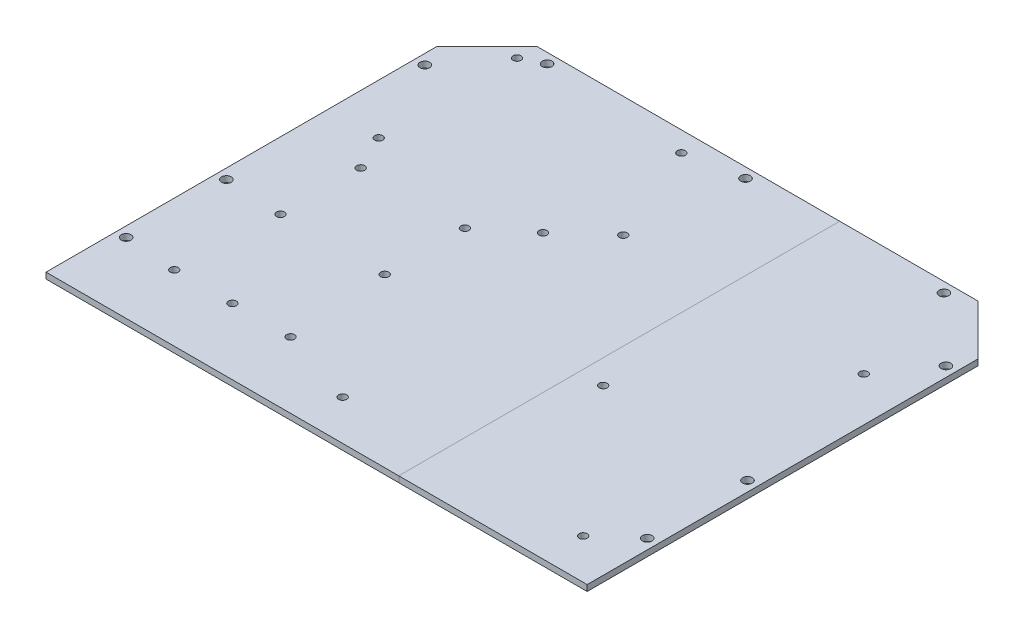
from build123d import *
from build123d.topology import SkipClean

# Parameters (mm, degrees)
SKETCH1_W                        = 270
SKETCH1_H                        = 270
BOSS_EXTRUDE1_DEPTH              = 3
M4_CLEARANCE_HOLE1_D             = 4.8
SKETCH6_W                        = 270
SKETCH6_H                        = 50
CUT_EXTRUDE1_DEPTH               = 191.942399692
F_4_0_4_DIAMETER_HOLE1_OUTLINE_R = 2
F_4_0_4_DIAMETER_HOLE1_DEPTH     = 3
CHAMFER1_SIZE                    = 25
BOSS_EXTRUDE2_START              = 2.5
SKETCH10_R                       = 5
SKETCH10_R_2                     = 2
BOSS_EXTRUDE2_DEPTH              = 2.5
FILLET1_R                        = 10


# Read off the part's stored shape, not the designer's step: Ø4.0 (4) Diameter Hole1
with BuildPart() as part:
    # Sketch1 → Boss-Extrude1 (new body)
    with BuildSketch(Plane(origin=(0, 0, 0), x_dir=(1, 0, 0), z_dir=(0, 1, 0))):
        Rectangle(SKETCH1_W, SKETCH1_H)
    extrude(amount=BOSS_EXTRUDE1_DEPTH)

    # M4 Clearance Hole1 (through all)
    with Locations(Plane(origin=(0, 3, 0), x_dir=(1, 0, 0), z_dir=(0, 1, 0))):
        with Locations((98, 130), (-1, 130), (-100, 130), (130, -50), (-130, -50), (-130, 0), (130, 99), (-130, 99), (130, 0)):
            Hole(M4_CLEARANCE_HOLE1_D / 2)

    # Sketch6 → Cut-Extrude1 (cut, through all)
    with BuildSketch(Plane(origin=(0, 3, 0), x_dir=(1, 0, 0), z_dir=(0, 1, 0))):
        with Locations((0, -110)):
            Rectangle(SKETCH6_W, SKETCH6_H)
    extrude(amount=-CUT_EXTRUDE1_DEPTH, mode=Mode.SUBTRACT)

    # Ø4.0 (4) Diameter Hole1 outline → Ø4.0 (4) Diameter Hole1 (cut)
    with BuildSketch(Plane(origin=(0, 0, 0), x_dir=(1, 0, 0), z_dir=(0, 1, 0))):
        with Locations((-75, -52)):
            Circle(F_4_0_4_DIAMETER_HOLE1_OUTLINE_R)
        with Locations((-104, -52)):
            Circle(F_4_0_4_DIAMETER_HOLE1_OUTLINE_R)
        with Locations((-46, -52)):
            Circle(F_4_0_4_DIAMETER_HOLE1_OUTLINE_R)
        with Locations((53, 5)):
            Circle(F_4_0_4_DIAMETER_HOLE1_OUTLINE_R)
        with Locations((113, -65)):
            Circle(F_4_0_4_DIAMETER_HOLE1_OUTLINE_R)
        with Locations((-7, 75)):
            Circle(F_4_0_4_DIAMETER_HOLE1_OUTLINE_R)
        with Locations((-7, -65)):
            Circle(F_4_0_4_DIAMETER_HOLE1_OUTLINE_R)
        with Locations((113, 75)):
            Circle(F_4_0_4_DIAMETER_HOLE1_OUTLINE_R)
        with Locations((-49.5, -1.5)):
            Circle(F_4_0_4_DIAMETER_HOLE1_OUTLINE_R)
        with Locations((-49.5, 38.5)):
            Circle(F_4_0_4_DIAMETER_HOLE1_OUTLINE_R)
        with Locations((-101.5, -1.5)):
            Circle(F_4_0_4_DIAMETER_HOLE1_OUTLINE_R)
        with Locations((-101.5, 38.5)):
            Circle(F_4_0_4_DIAMETER_HOLE1_OUTLINE_R)
        with Locations((-28, 56)):
            Circle(F_4_0_4_DIAMETER_HOLE1_OUTLINE_R)
        with Locations((-110, 56)):
            Circle(F_4_0_4_DIAMETER_HOLE1_OUTLINE_R)
        with Locations((-28, 125)):
            Circle(F_4_0_4_DIAMETER_HOLE1_OUTLINE_R)
        with Locations((-110, 125)):
            Circle(F_4_0_4_DIAMETER_HOLE1_OUTLINE_R)
    extrude(amount=F_4_0_4_DIAMETER_HOLE1_DEPTH, mode=Mode.SUBTRACT)

    # Chamfer1
    chamfer1_edges = [part.edges().sort_by_distance(p)[0] for p in [
        (-135, 1.5, -135),
        (135, 1.5, -135),
    ]]
    chamfer(chamfer1_edges, length=CHAMFER1_SIZE)

    # Sketch10 → Boss-Extrude2 (add)
    # profile 1 of 16: a face of its own
    with SkipClean():  # the faces are left unmerged after this step: merging them gives an invalid solid
        with BuildSketch(Plane.XZ.offset(BOSS_EXTRUDE2_START)):
            with Locations(Location((-75, 52, 0), (0, 0, 270))):
                Circle(SKETCH10_R)
            with Locations(Location((-75, 52, 0), (0, 0, 90))):
                Circle(SKETCH10_R_2, mode=Mode.SUBTRACT)
        # profile 2 of 16: a face of its own
        with BuildSketch(Plane.XZ.offset(BOSS_EXTRUDE2_START)):
            with Locations(Location((-104, 52, 0), (0, 0, 270))):
                Circle(SKETCH10_R)
            with Locations(Location((-104, 52, 0), (0, 0, 90))):
                Circle(SKETCH10_R_2, mode=Mode.SUBTRACT)
        # profile 3 of 16: a face of its own
        with BuildSketch(Plane.XZ.offset(BOSS_EXTRUDE2_START)):
            with Locations(Location((-46, 52, 0), (0, 0, 270))):
                Circle(SKETCH10_R)
            with Locations(Location((-46, 52, 0), (0, 0, 90))):
                Circle(SKETCH10_R_2, mode=Mode.SUBTRACT)
        # profile 4 of 16: a face of its own
        with BuildSketch(Plane.XZ.offset(BOSS_EXTRUDE2_START)):
            with Locations(Location((53, -5, 0), (0, 0, 270))):
                Circle(SKETCH10_R)
            with Locations(Location((53, -5, 0), (0, 0, 90))):
                Circle(SKETCH10_R_2, mode=Mode.SUBTRACT)
        # profile 5 of 16: a face of its own
        with BuildSketch(Plane.XZ.offset(BOSS_EXTRUDE2_START)):
            with Locations(Location((113, 65, 0), (0, 0, 270))):
                Circle(SKETCH10_R)
            with Locations(Location((113, 65, 0), (0, 0, 90))):
                Circle(SKETCH10_R_2, mode=Mode.SUBTRACT)
        # profile 6 of 16: a face of its own
        with BuildSketch(Plane.XZ.offset(BOSS_EXTRUDE2_START)):
            with Locations(Location((-7, -75, 0), (0, 0, 270))):
                Circle(SKETCH10_R)
            with Locations(Location((-7, -75, 0), (0, 0, 90))):
                Circle(SKETCH10_R_2, mode=Mode.SUBTRACT)
        # profile 7 of 16: a face of its own
        with BuildSketch(Plane.XZ.offset(BOSS_EXTRUDE2_START)):
            with Locations(Location((-7, 65, 0), (0, 0, 270))):
                Circle(SKETCH10_R)
            with Locations(Location((-7, 65, 0), (0, 0, 90))):
                Circle(SKETCH10_R_2, mode=Mode.SUBTRACT)
        # profile 8 of 16: a face of its own
        with BuildSketch(Plane.XZ.offset(BOSS_EXTRUDE2_START)):
            with Locations(Location((113, -75, 0), (0, 0, 270))):
                Circle(SKETCH10_R)
            with Locations(Location((113, -75, 0), (0, 0, 90))):
                Circle(SKETCH10_R_2, mode=Mode.SUBTRACT)
        # profile 9 of 16: a face of its own
        with BuildSketch(Plane.XZ.offset(BOSS_EXTRUDE2_START)):
            with Locations(Location((-49.5, 1.5, 0), (0, 0, 270))):
                Circle(SKETCH10_R)
            with Locations(Location((-49.5, 1.5, 0), (0, 0, 90))):
                Circle(SKETCH10_R_2, mode=Mode.SUBTRACT)
        # profile 10 of 16: a face of its own
        with BuildSketch(Plane.XZ.offset(BOSS_EXTRUDE2_START)):
            with Locations(Location((-49.5, -38.5, 0), (0, 0, 270))):
                Circle(SKETCH10_R)
            with Locations(Location((-49.5, -38.5, 0), (0, 0, 90))):
                Circle(SKETCH10_R_2, mode=Mode.SUBTRACT)
        # profile 11 of 16: a face of its own
        with BuildSketch(Plane.XZ.offset(BOSS_EXTRUDE2_START)):
            with Locations(Location((-101.5, 1.5, 0), (0, 0, 270))):
                Circle(SKETCH10_R)
            with Locations(Location((-101.5, 1.5, 0), (0, 0, 90))):
                Circle(SKETCH10_R_2, mode=Mode.SUBTRACT)
        # profile 12 of 16: a face of its own
        with BuildSketch(Plane.XZ.offset(BOSS_EXTRUDE2_START)):
            with Locations(Location((-101.5, -38.5, 0), (0, 0, 270))):
                Circle(SKETCH10_R)
            with Locations(Location((-101.5, -38.5, 0), (0, 0, 90))):
                Circle(SKETCH10_R_2, mode=Mode.SUBTRACT)
        # profile 13 of 16: a face of its own
        with BuildSketch(Plane.XZ.offset(BOSS_EXTRUDE2_START)):
            with Locations(Location((-28, -56, 0), (0, 0, 270))):
                Circle(SKETCH10_R)
            with Locations(Location((-28, -56, 0), (0, 0, 90))):
                Circle(SKETCH10_R_2, mode=Mode.SUBTRACT)
        # profile 14 of 16: a face of its own
        with BuildSketch(Plane.XZ.offset(BOSS_EXTRUDE2_START)):
            with Locations(Location((-110, -56, 0), (0, 0, 270))):
                Circle(SKETCH10_R)
            with Locations(Location((-110, -56, 0), (0, 0, 90))):
                Circle(SKETCH10_R_2, mode=Mode.SUBTRACT)
        # profile 15 of 16: a face of its own
        with BuildSketch(Plane.XZ.offset(BOSS_EXTRUDE2_START)):
            with Locations(Location((-28, -125, 0), (0, 0, 270))):
                Circle(SKETCH10_R)
            with Locations(Location((-28, -125, 0), (0, 0, 90))):
                Circle(SKETCH10_R_2, mode=Mode.SUBTRACT)
        # profile 16 of 16: a face of its own
        with BuildSketch(Plane.XZ.offset(BOSS_EXTRUDE2_START)):
            with Locations(Location((-110, -125, 0), (0, 0, 270))):
                Circle(SKETCH10_R)
            with Locations(Location((-110, -125, 0), (0, 0, 90))):
                Circle(SKETCH10_R_2, mode=Mode.SUBTRACT)
        extrude(amount=-BOSS_EXTRUDE2_DEPTH)

    # Fillet1
    # the kernel refuses this fillet: 10 mm, written as the material it adds along each edge
    with BuildSketch(Plane(origin=(-7, 0, -75), x_dir=(0, 0, -1), z_dir=(-1, 0, 0))) as fillet1_piece_1:
        with BuildLine():
            CenterArc((11.614378278, 10), FILLET1_R, 228.590377891, 41.409622109)
            Line((5, 2.5), (4.867712434, 2.35))
            ThreePointArc((4.867712434, 2.35), (4.8, 1.25), (4.8, 0))
            Line((4.8, 0), (5, -0.2))
            Line((5, -0.2), (11.614378278, -0.2))
            Line((11.614378278, -0.2), (11.614378278, 0))
        make_face()
    revolve(axis=Axis((-7, 0, -75), (0, -1, 0)))
    with BuildSketch(Plane(origin=(-7, 0, 65), x_dir=(0, 0, -1), z_dir=(-1, 0, 0))) as fillet1_piece_2:
        with BuildLine():
            CenterArc((11.614378278, 10), FILLET1_R, 228.590377891, 41.409622109)
            Line((5, 2.5), (4.867712434, 2.35))
            ThreePointArc((4.867712434, 2.35), (4.8, 1.25), (4.8, 0))
            Line((4.8, 0), (5, -0.2))
            Line((5, -0.2), (11.614378278, -0.2))
            Line((11.614378278, -0.2), (11.614378278, 0))
        make_face()
    revolve(axis=Axis((-7, 0, 65), (0, -1, 0)))
    with BuildSketch(Plane(origin=(113, 0, -75), x_dir=(0, 0, -1), z_dir=(-1, 0, 0))) as fillet1_piece_3:
        with BuildLine():
            CenterArc((11.614378278, 10), FILLET1_R, 228.590377891, 41.409622109)
            Line((5, 2.5), (4.867712434, 2.35))
            ThreePointArc((4.867712434, 2.35), (4.8, 1.25), (4.8, 0))
            Line((4.8, 0), (5, -0.2))
            Line((5, -0.2), (11.614378278, -0.2))
            Line((11.614378278, -0.2), (11.614378278, 0))
        make_face()
    revolve(axis=Axis((113, 0, -75), (0, -1, 0)))
    with BuildSketch(Plane(origin=(-49.5, 0, 1.5), x_dir=(0, 0, -1), z_dir=(-1, 0, 0))) as fillet1_piece_4:
        with BuildLine():
            CenterArc((11.614378278, 10), FILLET1_R, 228.590377891, 41.409622109)
            Line((5, 2.5), (4.867712434, 2.35))
            ThreePointArc((4.867712434, 2.35), (4.8, 1.25), (4.8, 0))
            Line((4.8, 0), (5, -0.2))
            Line((5, -0.2), (11.614378278, -0.2))
            Line((11.614378278, -0.2), (11.614378278, 0))
        make_face()
    revolve(axis=Axis((-49.5, 0, 1.5), (0, -1, 0)))
    with BuildSketch(Plane(origin=(113, 0, 65), x_dir=(0, 0, -1), z_dir=(-1, 0, 0))) as fillet1_piece_5:
        with BuildLine():
            CenterArc((11.614378278, 10), FILLET1_R, 228.590377891, 41.409622109)
            Line((5, 2.5), (4.867712434, 2.35))
            ThreePointArc((4.867712434, 2.35), (4.8, 1.25), (4.8, 0))
            Line((4.8, 0), (5, -0.2))
            Line((5, -0.2), (11.614378278, -0.2))
            Line((11.614378278, -0.2), (11.614378278, 0))
        make_face()
    revolve(axis=Axis((113, 0, 65), (0, -1, 0)))
    with BuildSketch(Plane(origin=(53, 0, -5), x_dir=(0, 0, -1), z_dir=(-1, 0, 0))) as fillet1_piece_6:
        with BuildLine():
            CenterArc((11.614378278, 10), FILLET1_R, 228.590377891, 41.409622109)
            Line((5, 2.5), (4.867712434, 2.35))
            ThreePointArc((4.867712434, 2.35), (4.8, 1.25), (4.8, 0))
            Line((4.8, 0), (5, -0.2))
            Line((5, -0.2), (11.614378278, -0.2))
            Line((11.614378278, -0.2), (11.614378278, 0))
        make_face()
    revolve(axis=Axis((53, 0, -5), (0, -1, 0)))
    with BuildSketch(Plane(origin=(-46, 0, 52), x_dir=(0, 0, -1), z_dir=(-1, 0, 0))) as fillet1_piece_7:
        with BuildLine():
            CenterArc((11.614378278, 10), FILLET1_R, 228.590377891, 41.409622109)
            Line((5, 2.5), (4.867712434, 2.35))
            ThreePointArc((4.867712434, 2.35), (4.8, 1.25), (4.8, 0))
            Line((4.8, 0), (5, -0.2))
            Line((5, -0.2), (11.614378278, -0.2))
            Line((11.614378278, -0.2), (11.614378278, 0))
        make_face()
    revolve(axis=Axis((-46, 0, 52), (0, -1, 0)))
    with BuildSketch(Plane(origin=(-104, 0, 52), x_dir=(0, 0, -1), z_dir=(-1, 0, 0))) as fillet1_piece_8:
        with BuildLine():
            CenterArc((11.614378278, 10), FILLET1_R, 228.590377891, 41.409622109)
            Line((5, 2.5), (4.867712434, 2.35))
            ThreePointArc((4.867712434, 2.35), (4.8, 1.25), (4.8, 0))
            Line((4.8, 0), (5, -0.2))
            Line((5, -0.2), (11.614378278, -0.2))
            Line((11.614378278, -0.2), (11.614378278, 0))
        make_face()
    revolve(axis=Axis((-104, 0, 52), (0, -1, 0)))
    with BuildSketch(Plane(origin=(-110, 0, -56), x_dir=(0, 0, -1), z_dir=(-1, 0, 0))) as fillet1_piece_9:
        with BuildLine():
            CenterArc((11.614378278, 10), FILLET1_R, 228.590377891, 41.409622109)
            Line((5, 2.5), (4.867712434, 2.35))
            ThreePointArc((4.867712434, 2.35), (4.8, 1.25), (4.8, 0))
            Line((4.8, 0), (5, -0.2))
            Line((5, -0.2), (11.614378278, -0.2))
            Line((11.614378278, -0.2), (11.614378278, 0))
        make_face()
    revolve(axis=Axis((-110, 0, -56), (0, -1, 0)))
    with BuildSketch(Plane(origin=(-28, 0, -125), x_dir=(0, 0, -1), z_dir=(-1, 0, 0))) as fillet1_piece_10_section:
        with BuildLine():
            CenterArc((11.614378278, 10), FILLET1_R, 228.590377891, 41.409622109)
            Line((5, 2.5), (4.867712434, 2.35))
            ThreePointArc((4.867712434, 2.35), (4.8, 1.25), (4.8, 0))
            Line((4.8, 0), (5, -0.2))
            Line((5, -0.2), (11.614378278, -0.2))
            Line((11.614378278, -0.2), (11.614378278, 0))
        make_face()
    fillet1_piece_10 = revolve(axis=Axis((-28, 0, -125), (0, -1, 0)), mode=Mode.PRIVATE)
    fillet1_piece_10 = split(fillet1_piece_10, bisect_by=Plane(origin=(-28, -0.583455208, -135), z_dir=(0, 0, 1)), keep=Keep.TOP, mode=Mode.PRIVATE)
    add(fillet1_piece_10)
    with BuildSketch(Plane(origin=(-49.5, 0, -38.5), x_dir=(0, 0, -1), z_dir=(-1, 0, 0))) as fillet1_piece_11:
        with BuildLine():
            CenterArc((11.614378278, 10), FILLET1_R, 228.590377891, 41.409622109)
            Line((5, 2.5), (4.867712434, 2.35))
            ThreePointArc((4.867712434, 2.35), (4.8, 1.25), (4.8, 0))
            Line((4.8, 0), (5, -0.2))
            Line((5, -0.2), (11.614378278, -0.2))
            Line((11.614378278, -0.2), (11.614378278, 0))
        make_face()
    revolve(axis=Axis((-49.5, 0, -38.5), (0, -1, 0)))
    with BuildSketch(Plane(origin=(-101.5, 0, 1.5), x_dir=(0, 0, -1), z_dir=(-1, 0, 0))) as fillet1_piece_12:
        with BuildLine():
            CenterArc((11.614378278, 10), FILLET1_R, 228.590377891, 41.409622109)
            Line((5, 2.5), (4.867712434, 2.35))
            ThreePointArc((4.867712434, 2.35), (4.8, 1.25), (4.8, 0))
            Line((4.8, 0), (5, -0.2))
            Line((5, -0.2), (11.614378278, -0.2))
            Line((11.614378278, -0.2), (11.614378278, 0))
        make_face()
    revolve(axis=Axis((-101.5, 0, 1.5), (0, -1, 0)))
    with BuildSketch(Plane(origin=(-101.5, 0, -38.5), x_dir=(0, 0, -1), z_dir=(-1, 0, 0))) as fillet1_piece_13:
        with BuildLine():
            CenterArc((11.614378278, 10), FILLET1_R, 228.590377891, 41.409622109)
            Line((5, 2.5), (4.867712434, 2.35))
            ThreePointArc((4.867712434, 2.35), (4.8, 1.25), (4.8, 0))
            Line((4.8, 0), (5, -0.2))
            Line((5, -0.2), (11.614378278, -0.2))
            Line((11.614378278, -0.2), (11.614378278, 0))
        make_face()
    revolve(axis=Axis((-101.5, 0, -38.5), (0, -1, 0)))
    with BuildSketch(Plane(origin=(-28, 0, -56), x_dir=(0, 0, -1), z_dir=(-1, 0, 0))) as fillet1_piece_14:
        with BuildLine():
            CenterArc((11.614378278, 10), FILLET1_R, 228.590377891, 41.409622109)
            Line((5, 2.5), (4.867712434, 2.35))
            ThreePointArc((4.867712434, 2.35), (4.8, 1.25), (4.8, 0))
            Line((4.8, 0), (5, -0.2))
            Line((5, -0.2), (11.614378278, -0.2))
            Line((11.614378278, -0.2), (11.614378278, 0))
        make_face()
    revolve(axis=Axis((-28, 0, -56), (0, -1, 0)))
    with BuildSketch(Plane(origin=(-75, 0, 52), x_dir=(0, 0, -1), z_dir=(-1, 0, 0))) as fillet1_piece_15:
        with BuildLine():
            CenterArc((11.614378278, 10), FILLET1_R, 228.590377891, 41.409622109)
            Line((5, 2.5), (4.867712434, 2.35))
            ThreePointArc((4.867712434, 2.35), (4.8, 1.25), (4.8, 0))
            Line((4.8, 0), (5, -0.2))
            Line((5, -0.2), (11.614378278, -0.2))
            Line((11.614378278, -0.2), (11.614378278, 0))
        make_face()
    revolve(axis=Axis((-75, 0, 52), (0, -1, 0)))


with BuildPart() as body_2:
    # Split1: the piece on the far side of the plane
    add(part.part)
    split(bisect_by=Plane(origin=(41, 0, 0), x_dir=(0, 0, 1), z_dir=(1, 0, 0)), keep=Keep.BOTTOM)


with BuildPart() as part_1:
    add(part.part)

    # Split1
    split(bisect_by=Plane(origin=(41, 0, 0), x_dir=(0, 0, 1), z_dir=(1, 0, 0)), keep=Keep.TOP)


solid = Compound([body_2.part, part_1.part])
